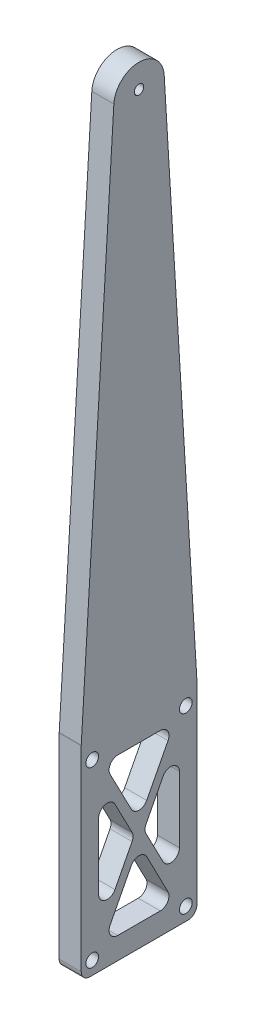
from build123d import *

# Parameters (mm, degrees)
SKETCH1_W             = 33.29
SKETCH1_H             = 58.96
SKETCH1_R             = 1.8288
BOSS_EXTRUDE1_DEPTH   = 6.35
CUT_EXTRUDE1_DEPTH    = 169.208568246
FILLET1_R             = 2.5
FILLET2_R             = 2.5
F_6_32_TAPPED_HOLE1_D = 2.7051


with BuildPart() as part:
    # Sketch1 → Boss-Extrude1 (new body)
    # profile 1 of 2: a face of its own
    with BuildSketch(Plane(origin=(0, 0, 0), x_dir=(0, 0, -1), z_dir=(1, 0, 0))):
        with BuildLine():
            ThreePointArc((-7.249242854, 160.438616345), (0, 167.2625), (7.249242854, 160.438616345))
            Line((7.249242854, 160.438616345), (16.645, 5.15))
            Line((16.645, 5.15), (-16.645, 5.15))
            Line((-16.645, 5.15), (-7.249242854, 160.438616345))
        make_face()
    # profile 2 of 2: a face of its own
    with BuildSketch(Plane(origin=(0, 0, 0), x_dir=(0, 0, -1), z_dir=(1, 0, 0))):
        with Locations((0, -24.33)):
            Rectangle(SKETCH1_W, SKETCH1_H)
        with Locations((13.4747, -50)):
            Circle(SKETCH1_R, mode=Mode.SUBTRACT)
        with Locations((-13.4747, -50)):
            Circle(SKETCH1_R, mode=Mode.SUBTRACT)
        with Locations((13.4747, 0)):
            Circle(SKETCH1_R, mode=Mode.SUBTRACT)
        with Locations((-13.4747, 0)):
            Circle(SKETCH1_R, mode=Mode.SUBTRACT)
    extrude(amount=BOSS_EXTRUDE1_DEPTH)

    # Sketch2 → Cut-Extrude1 (cut, through all)
    with BuildSketch(Plane(origin=(6.35, 0, 0), x_dir=(0, 0, -1), z_dir=(1, 0, 0))):
        Polygon((11.645, -5.219501679), (1.407493202, -25), (11.645, -44.780498321), align=None)
        Polygon((0, -27.719501679), (-10.237506798, -47.5), (10.237506798, -47.5), align=None)
        Polygon((-11.645, -5.219501679), (-11.645, -44.780498321), (-1.407493202, -25), align=None)
        Polygon((-10.237506798, -2.5), (0, -22.280498321), (10.237506798, -2.5), align=None)
    extrude(amount=-CUT_EXTRUDE1_DEPTH, mode=Mode.SUBTRACT)

    # Fillet1
    fillet1_edges = [part.edges().sort_by_distance(p)[0] for p in [
        (3.175, -44.780498321, 11.645),
        (3.175, -5.219501679, 11.645),
        (3.175, -25, 1.407493202),
        (3.175, -47.5, -10.237506798),
        (3.175, -47.5, 10.237506798),
        (3.175, -27.719501679, 0),
        (3.175, -22.280498321, 0),
        (3.175, -2.5, 10.237506798),
        (3.175, -2.5, -10.237506798),
        (3.175, -25, -1.407493202),
        (3.175, -5.219501679, -11.645),
        (3.175, -44.780498321, -11.645),
    ]]
    fillet(fillet1_edges, radius=FILLET1_R)

    # Fillet2
    # the kernel refuses this fillet: 2.5 mm, written as the material it takes off along each edge
    with BuildSketch(Plane(origin=(-0.188905784, 5.15, -16.645), x_dir=(0, 0.9981745753787551, 0.06039467747609822), z_dir=(1, 0, 0))) as fillet2_piece_1:
        with BuildLine():
            CenterArc((FILLET2_R * 0.0302249253995, FILLET2_R), FILLET2_R, 266.537532795, 3.462467205)
            Line((-FILLET2_R * 0.0301697520766, FILLET2_R * 0.00182542462124), (0, 0))
            Line((0, 0), (FILLET2_R * 0.0302249253996, 0))
        make_face()
    extrude(amount=6.727811567, mode=Mode.SUBTRACT)
    with BuildSketch(Plane(origin=(-6.25, -53.81, -16.645), x_dir=(0, 1, 0), z_dir=(1, 0, 0))) as fillet2_piece_2:
        with BuildLine():
            CenterArc((FILLET2_R, FILLET2_R), FILLET2_R, 180, 90)
            Line((0, FILLET2_R), (0, 0))
            Line((0, 0), (FILLET2_R, 0))
        make_face()
    extrude(amount=18.85, mode=Mode.SUBTRACT)
    with BuildSketch(Plane(origin=(-6.25, -53.81, 16.645), x_dir=(0, 1, 0), z_dir=(1, 0, 0))) as fillet2_piece_3:
        with BuildLine():
            CenterArc((FILLET2_R, -FILLET2_R), FILLET2_R, 90, 90)
            Line((0, -FILLET2_R), (0, 0))
            Line((0, 0), (FILLET2_R, 0))
        make_face()
    extrude(amount=18.85, mode=Mode.SUBTRACT)
    with BuildSketch(Plane(origin=(-0.188905784, 5.15, 16.645), x_dir=(0, 0.9981745753787543, -0.06039467747611318), z_dir=(1, 0, 0))) as fillet2_piece_4:
        with BuildLine():
            CenterArc((FILLET2_R * 0.0302249253995, -FILLET2_R), FILLET2_R, 90, 3.462467205)
            Line((-FILLET2_R * 0.0301697520766, -FILLET2_R * 0.00182542462124), (0, 0))
            Line((0, 0), (FILLET2_R * 0.0302249253996, 0))
        make_face()
    extrude(amount=6.727811567, mode=Mode.SUBTRACT)

    # #6-32 Tapped Hole1 (through all)
    with Locations(Plane(origin=(6.35, 0, 0), x_dir=(0, 0, -1), z_dir=(1, 0, 0))):
        with Locations((0, 160.438616345)):
            Hole(F_6_32_TAPPED_HOLE1_D / 2)


solid = part.part
